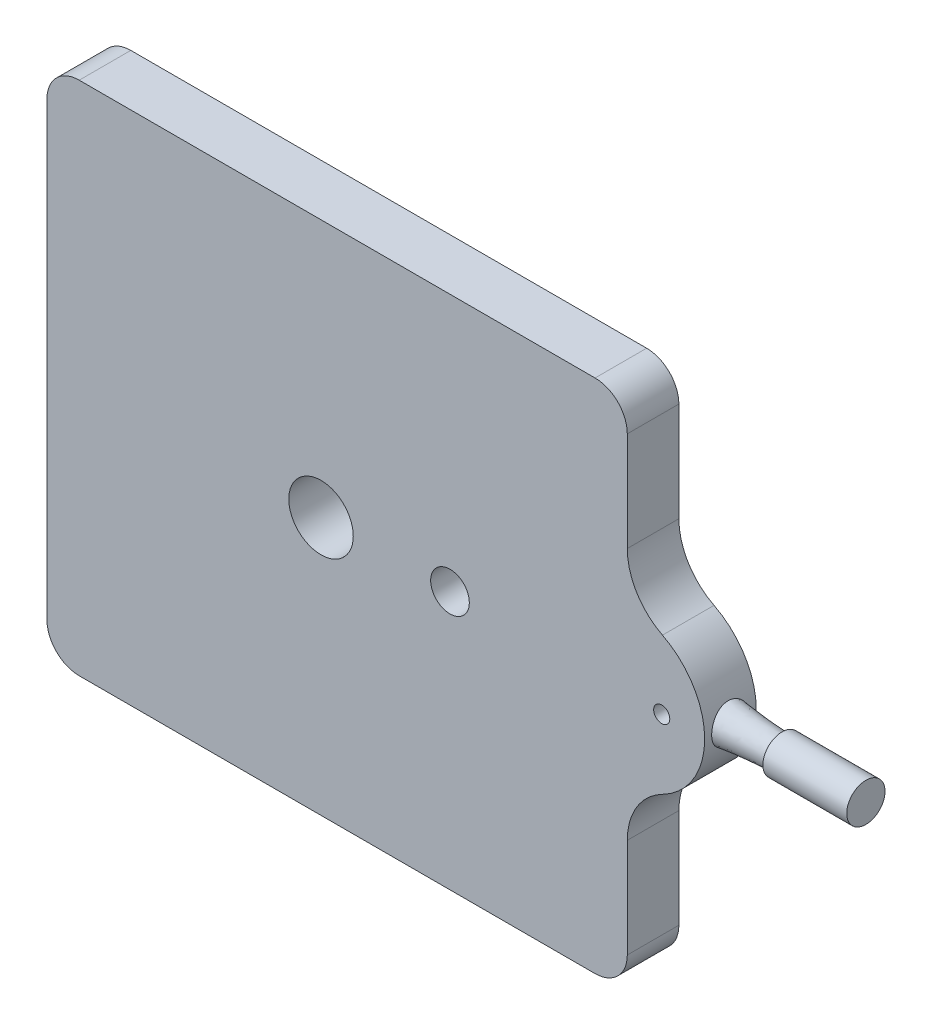
from build123d import *

# Parameters (mm, degrees)
SKETCH1_R                = 5
BOSS_EXTRUDE1_DEPTH      = 8
BOSS_EXTRUDE2_DEPTH      = 10
BOSS_EXTRUDE2_DEPTH_BACK = 3
SKETCH4_R                = 2.970033329
FILLET6_R                = 5
SKETCH5_R                = 1.25
CUT_EXTRUDE2_DEPTH       = 10
SKETCH6_R                = 3
CUT_EXTRUDE3_DEPTH       = 10


with BuildPart() as part:
    # Sketch1 → Boss-Extrude1 (new body)
    with BuildSketch(Plane.XY):
        with BuildLine():
            Line((0, 25.404082058), (0, 80))
            Line((0, 80), (90, 80))
            Line((90, 80), (90, 59.595917942))
            ThreePointArc((90, 59.595917942), (91.471971346, 54.373588264), (95.454545455, 50.688682514))
            ThreePointArc((95.454545455, 50.688682514), (102, 40), (95.454545455, 29.311317486))
            ThreePointArc((95.454545455, 29.311317486), (91.471971346, 25.626411736), (90, 20.404082058))
            Line((90, 20.404082058), (90, 0))
            Line((90, 0), (0, 0))
            Line((0, 0), (0, 25.404082058))
        make_face()
        with Locations((42.5, 40)):
            Circle(SKETCH1_R, mode=Mode.SUBTRACT)
    extrude(amount=BOSS_EXTRUDE1_DEPTH)

    # Loft1: read off the stored shape, not the designer's step
    # Loft1: loft between two sections, ruled curve by curve
    loft1_from = [
        Edge.make_bspline([(98, 43.257575322, 2.799379564), (98, 45.658816193, 9.314530208), (98, 39.143665549, 11.715771079), (98, 36.742424678, 5.200620436), (98, 34.341183807, -1.314530208), (98, 40.856334451, -3.715771079), (98, 43.257575322, 2.799379564)], [0, 0, 0, 0, 0.5, 0.5, 0.5, 1, 1, 1, 1], 3, [1, 0.333333333, 0.333333333, 1, 0.333333333, 0.333333333, 1]),
    ]
    loft1_to = [
        Edge.make_bspline([(113, 40.429483248, 1.709498759), (113, 45.010485729, 2.568465255), (113, 44.151519233, 7.149467737), (113, 39.570516752, 6.290501241), (113, 34.989514271, 5.431534745), (113, 35.848480767, 0.850532263), (113, 40.429483248, 1.709498759)], [0, 0, 0, 0, 0.5, 0.5, 0.5, 1, 1, 1, 1], 3, [1, 0.333333333, 0.333333333, 1, 0.333333333, 0.333333333, 1]),
    ]
    loft1 = Solid(Shell([*[Face.make_surface_from_curves(loft1_from[k], loft1_to[k]) for k in range(1)], Face(Wire(loft1_from)), Face(Wire(loft1_to))]))
    add(loft1)

    # Sketch4 → Boss-Extrude2 (add, two sides: drawn at the far end of the back side and taken through both)
    with BuildSketch(Plane(origin=(113, 0, 0), x_dir=(0, 0, -1), z_dir=(1, 0, 0)).offset(-BOSS_EXTRUDE2_DEPTH_BACK)):
        with Locations((-4, 40)):
            Circle(SKETCH4_R)
    extrude(amount=BOSS_EXTRUDE2_DEPTH + BOSS_EXTRUDE2_DEPTH_BACK)

    # Fillet6
    fillet6_edges = [part.edges().sort_by_distance(p)[0] for p in [
        (0, 80, 4),
        (90, 80, 4),
        (90, 0, 4),
        (0, 0, 4),
    ]]
    fillet(fillet6_edges, radius=FILLET6_R)

    # Sketch5 → Cut-Extrude2 (cut)
    with BuildSketch(Plane.XY.offset(8)):
        with Locations((95.34, 40)):
            Circle(SKETCH5_R)
    extrude(amount=-CUT_EXTRUDE2_DEPTH, mode=Mode.SUBTRACT)

    # Sketch6 → Cut-Extrude3 (cut)
    with BuildSketch(Plane.XY.offset(8)):
        with Locations((62.5, 40.062959469)):
            Circle(SKETCH6_R)
    extrude(amount=-CUT_EXTRUDE3_DEPTH, mode=Mode.SUBTRACT)


solid = part.part
